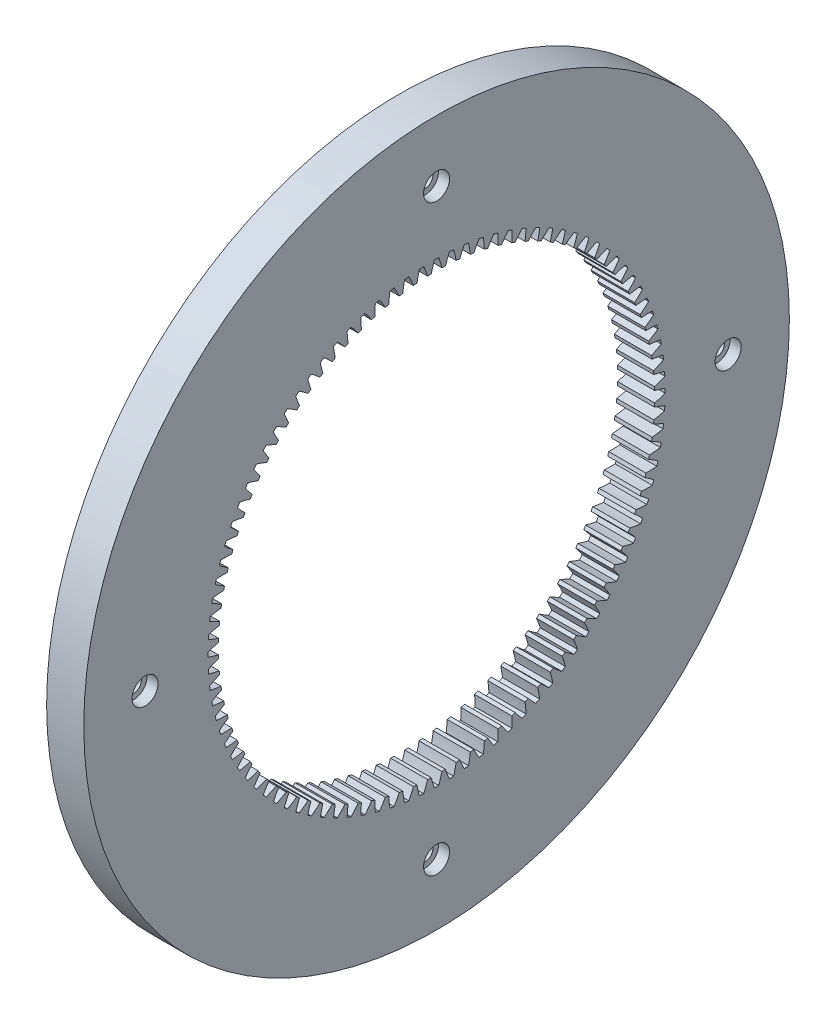
from build123d import *

# Parameters (mm, degrees)
BASPROSKE_W        = 10
BASPROSKE_H        = 36.25
TOOTHCUT_DEPTH     = 135.721935853
TEETHCUTS_COUNT    = 96
TEETHCUTS_ANGLE    = 356.25
SKETCH1_R          = 2
CUT_EXTRUDE1_DEPTH = 10
SKETCH2_R          = 3.5
CUT_EXTRUDE2_DEPTH = 3


with BuildPart() as part:
    # BasProSke → Base-Revolve (revolve)
    with BuildSketch(Plane(origin=(0, 0, 0), x_dir=(1, 0, 0), z_dir=(0, 1, 0))):
        with Locations((5, 76.875)):
            Rectangle(BASPROSKE_W, BASPROSKE_H)
    revolve(axis=Axis((-10, 0, 0), (1, 0, 0)))

    # TooCutSke → ToothCut (cut, through all)
    with BuildSketch(Plane(origin=(0, 0, 0), x_dir=(0, 0, -1), z_dir=(1, 0, 0))):
        with BuildLine():
            ThreePointArc((1.446756085, 58.706775946), (1.047572171, 60.144598159), (0.577386594, 61.560792368))
            ThreePointArc((0.577386594, 61.560792368), (0, 61.5635), (-0.577386594, 61.560792368))
            ThreePointArc((-0.577386594, 61.560792368), (-1.047572171, 60.144598159), (-1.446756085, 58.706775946))
            ThreePointArc((-1.446756085, 58.706775946), (0, 58.7246), (1.446756085, 58.706775946))
        make_face()
    toothcut = extrude(amount=TOOTHCUT_DEPTH, mode=Mode.SUBTRACT)

    # TeethCuts: ToothCut ×96 about axis
    teethcuts_axis = Axis((-10, 0, 0), (1, 0, 0))
    for i in range(1, TEETHCUTS_COUNT):
        add(toothcut.rotate(teethcuts_axis, i * TEETHCUTS_ANGLE / (TEETHCUTS_COUNT - 1)), mode=Mode.SUBTRACT)

    # Sketch1 → Cut-Extrude1 (cut)
    with BuildSketch(Plane(origin=(10, 0, 0), x_dir=(0, 0, -1), z_dir=(1, 0, 0))):
        with Locations((0, 78.5)):
            Circle(SKETCH1_R)
        with Locations((78.5, 0)):
            Circle(SKETCH1_R)
        with Locations((0, -78.5)):
            Circle(SKETCH1_R)
        with Locations((-78.5, 0)):
            Circle(SKETCH1_R)
    extrude(amount=-CUT_EXTRUDE1_DEPTH, mode=Mode.SUBTRACT)

    # Sketch2 → Cut-Extrude2 (cut)
    with BuildSketch(Plane(origin=(10, 0, 0), x_dir=(0, 0, -1), z_dir=(1, 0, 0))):
        with Locations((0, 78.5)):
            Circle(SKETCH2_R)
        with Locations((78.5, 0)):
            Circle(SKETCH2_R)
        with Locations((0, -78.5)):
            Circle(SKETCH2_R)
        with Locations((-78.5, 0)):
            Circle(SKETCH2_R)
    extrude(amount=-CUT_EXTRUDE2_DEPTH, mode=Mode.SUBTRACT)


solid = part.part
